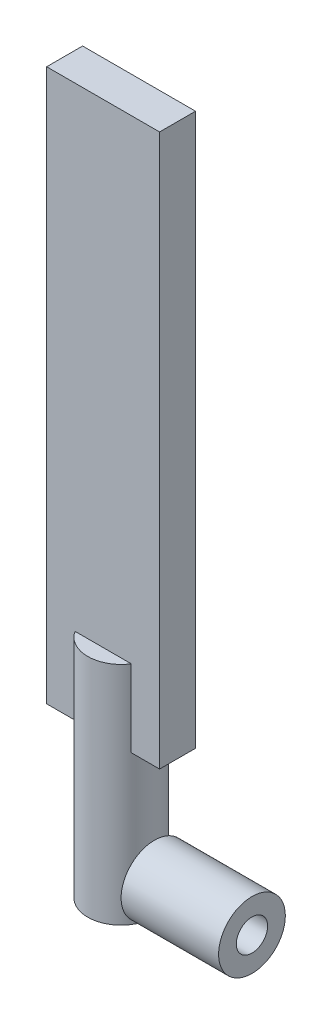
from build123d import *

# Parameters (mm, degrees)
SKETCH_1_R           = 6.5
EXTRUDE_1_DEPTH      = 19
SKETCH_2_R           = 3.05
CUT_EXTRUDE_1_DEPTH  = 5
EXTRUDE_2_DEPTH      = 37.5
EXTRUDE_2_DEPTH_BACK = 6.5
SKETCH_3_R           = 6.5
EXTRUDE_3_DEPTH      = 92.5
EXTRUDE_3_DEPTH_BACK = 15
SKETCH_4_W           = 22
SKETCH_4_H           = 7


with BuildPart() as part:
    # Эскиз1 → Бобышка-Вытянуть1 (new body)
    with BuildSketch(Plane(origin=(0, 0, 0), x_dir=(0, 0, -1), z_dir=(1, 0, 0))):
        Circle(SKETCH_1_R)
    extrude(amount=EXTRUDE_1_DEPTH)

    # Эскиз2 → Вырез-Вытянуть1 (cut)
    with BuildSketch(Plane(origin=(19, 0, 0), x_dir=(0, 0, -1), z_dir=(1, 0, 0))):
        Circle(SKETCH_2_R)
    extrude(amount=-CUT_EXTRUDE_1_DEPTH, mode=Mode.SUBTRACT)


with BuildPart() as body_2:
    # Эскиз3 → Бобышка-Вытянуть2 (new, two sides: drawn at the far end of the back side and taken through both)
    with BuildSketch(Plane(origin=(0, 0, 0), x_dir=(1, 0, 0), z_dir=(0, 1, 0)).offset(-EXTRUDE_2_DEPTH_BACK)):
        with Locations((-6.5, 0)):
            Circle(SKETCH_3_R)
    extrude(amount=EXTRUDE_2_DEPTH + EXTRUDE_2_DEPTH_BACK)

    # Эскиз4 → Бобышка-Вытянуть3 (add, two sides: drawn at the far end of the back side and taken through both)
    with BuildSketch(Plane(origin=(0, 37.5, 0), x_dir=(1, 0, 0), z_dir=(0, 1, 0)).offset(-EXTRUDE_3_DEPTH_BACK)):
        with Locations((-6.5, 0)):
            Rectangle(SKETCH_4_W, SKETCH_4_H)
    extrude(amount=EXTRUDE_3_DEPTH + EXTRUDE_3_DEPTH_BACK)


solid = Compound([part.part, body_2.part])
